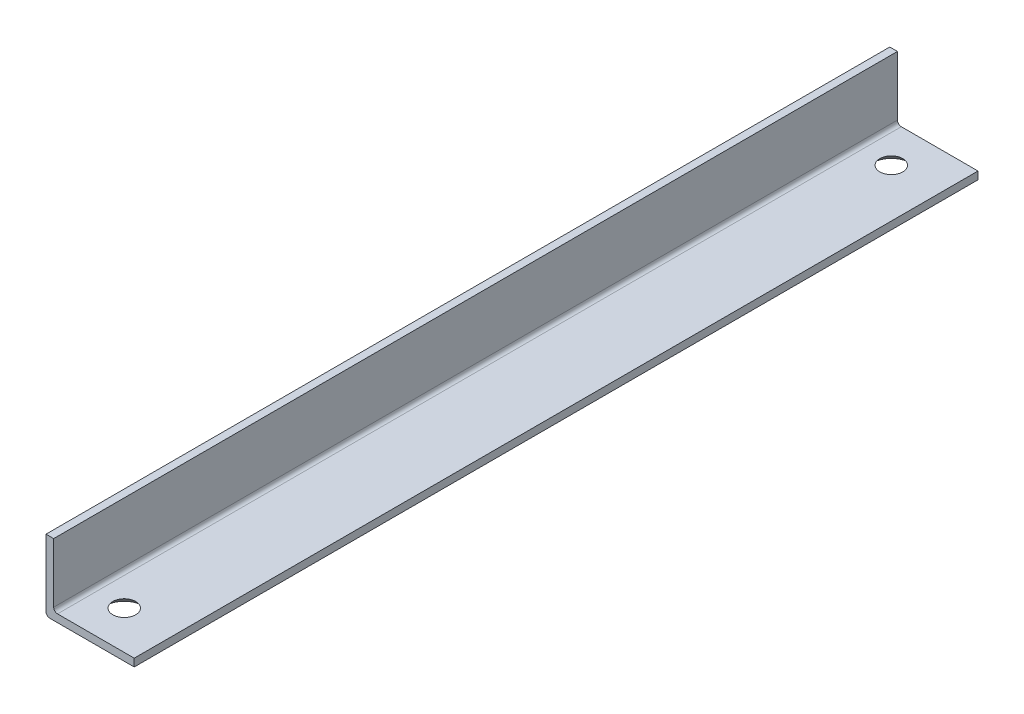
from build123d import *

# Parameters (mm, degrees)
BOSS_EXTRU_1_DEPTH      = 110
ESQUISSE2_R             = 1.5
ENL_V_MAT_EXTRU_1_DEPTH = 5
CHANFREIN1_SIZE         = 1


with BuildPart() as part:
    # Esquisse1 → Boss.-Extru.1 (new body)
    with BuildSketch(Plane.XY):
        with BuildLine():
            Line((0, 0.5), (0, 9.25))
            Line((0, 9.25), (1, 9.25))
            Line((1, 9.25), (1, 1.5))
            ThreePointArc((1, 1.5), (1.146446609, 1.146446609), (1.5, 1))
            Line((1.5, 1), (11.5, 1))
            Line((11.5, 1), (11.5, 0))
            Line((11.5, 0), (0.5, 0))
            ThreePointArc((0.5, 0), (0.146446609, 0.146446609), (0, 0.5))
        make_face()
    extrude(amount=BOSS_EXTRU_1_DEPTH)

    # Esquisse2 → Enlèv. mat.-Extru.1 (cut)
    with BuildSketch(Plane.XZ):
        with Locations((5.2, 5)):
            Circle(ESQUISSE2_R)
        with Locations((5.2, 105)):
            Circle(ESQUISSE2_R)
    extrude(amount=-ENL_V_MAT_EXTRU_1_DEPTH, mode=Mode.SUBTRACT)

    # Chanfrein1
    chanfrein1_edges = [part.edges().sort_by_distance(p)[0] for p in [
        (3.7, 0, 5),
        (3.7, 0, 105),
    ]]
    chamfer(chanfrein1_edges, length=CHANFREIN1_SIZE - 0.0001)  # a hair under: the kernel refuses the full size


solid = part.part
